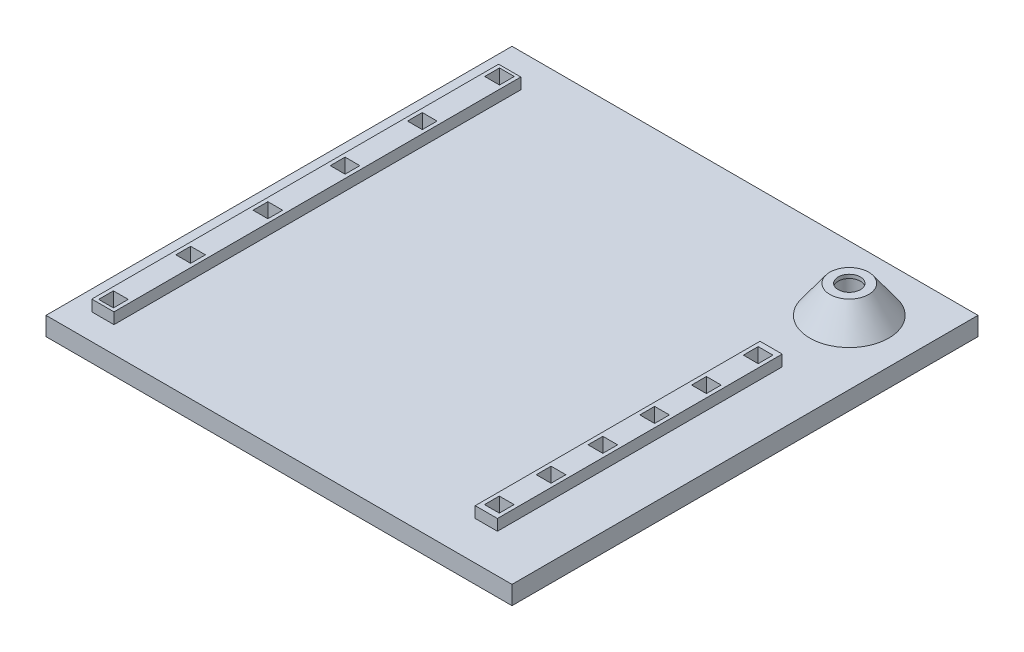
from build123d import *

# Parameters (mm, degrees)
SKETCH1_W           = 126
SKETCH1_H           = 126
BOSS_EXTRUDE1_DEPTH = 5
SKETCH3_R           = 12.5
BOSS_EXTRUDE2_DEPTH = 7.5
SKETCH4_R           = 3.45
CUT_EXTRUDE1_DEPTH  = 11.5
SKETCH6_R           = 3
CUT_EXTRUDE2_DEPTH  = 179.628805068
CHAMFER1_SIZE       = 10
CHAMFER1_SIZE_2     = 7.26542528
SKETCH9_W           = 6
SKETCH9_H           = 77
BOSS_EXTRUDE4_DEPTH = 3
SKETCH10_W          = 4
SKETCH10_H          = 4
CUT_EXTRUDE4_DEPTH  = 179.370401132
SKETCH11_W          = 6
SKETCH11_H          = 110
BOSS_EXTRUDE5_DEPTH = 3
SKETCH12_W          = 4
SKETCH12_H          = 4
CUT_EXTRUDE5_DEPTH  = 179.370401132


with BuildPart() as part:
    # Sketch1 → Boss-Extrude1 (new body)
    with BuildSketch(Plane(origin=(0, 0, 0), x_dir=(1, 0, 0), z_dir=(0, 1, 0))):
        with Locations((63, 63)):
            Rectangle(SKETCH1_W, SKETCH1_H)
    extrude(amount=BOSS_EXTRUDE1_DEPTH)

    # Sketch3 → Boss-Extrude2 (add)
    with BuildSketch(Plane(origin=(0, 5, 0), x_dir=(1, 0, 0), z_dir=(0, 1, 0))):
        with Locations(Location((108.6, 108.6, 0), (0, 0, 90))):
            Circle(SKETCH3_R)
    extrude(amount=BOSS_EXTRUDE2_DEPTH)

    # Sketch4 → Cut-Extrude1 (cut)
    with BuildSketch(Plane.XZ):
        with Locations(Location((108.6, -108.6, 0), (0, 0, 270))):
            Circle(SKETCH4_R)
    extrude(amount=-CUT_EXTRUDE1_DEPTH, mode=Mode.SUBTRACT)

    # Sketch6 → Cut-Extrude2 (cut, through all)
    with BuildSketch(Plane(origin=(0, 12.5, 0), x_dir=(1, 0, 0), z_dir=(0, 1, 0))):
        with Locations(Location((108.6, 108.6, 0), (0, 0, 270))):
            Circle(SKETCH6_R)
    extrude(amount=-CUT_EXTRUDE2_DEPTH, mode=Mode.SUBTRACT)

    # Chamfer1
    # the kernel refuses this chamfer: 10, 7.26542528 mm, written as the material it takes off along each edge
    with BuildSketch(Plane(origin=(108.6, 12.5, -108.6), x_dir=(0, 0, -1), z_dir=(1, 0, 0))) as chamfer1_piece_1_section:
        Polygon((12.5, -CHAMFER1_SIZE), (12.5 - CHAMFER1_SIZE_2, 0), (12.5, 0), align=None)
    chamfer1_piece_1 = revolve(axis=Axis((108.6, 12.5, -108.6), (0, 1, 0)), mode=Mode.PRIVATE)
    chamfer1_piece_1 = split(chamfer1_piece_1, bisect_by=Plane(origin=(108.6, 5, -100.650989912), z_dir=(0, 1, 0)), keep=Keep.TOP, mode=Mode.PRIVATE)
    add(chamfer1_piece_1, mode=Mode.SUBTRACT)

    # Sketch9 → Boss-Extrude4 (add)
    with BuildSketch(Plane(origin=(0, 5, 0), x_dir=(1, 0, 0), z_dir=(0, 1, 0))):
        with Locations((108.6, 48.95817816)):
            Rectangle(SKETCH9_W, SKETCH9_H)
    extrude(amount=BOSS_EXTRUDE4_DEPTH)

    # Sketch10 → Cut-Extrude4 (cut, through all)
    with BuildSketch(Plane(origin=(0, 8, 0), x_dir=(1, 0, 0), z_dir=(0, 1, 0))):
        with Locations((108.6, 83.95817816)):
            Rectangle(SKETCH10_W, SKETCH10_H)
        with Locations((108.6, 69.958932274)):
            Rectangle(SKETCH10_W, SKETCH10_H)
        with Locations((108.6, 55.959686388)):
            Rectangle(SKETCH10_W, SKETCH10_H)
        with Locations((108.6, 41.960440502)):
            Rectangle(SKETCH10_W, SKETCH10_H)
        with Locations((108.6, 27.961194616)):
            Rectangle(SKETCH10_W, SKETCH10_H)
        with Locations((108.6, 13.96194873)):
            Rectangle(SKETCH10_W, SKETCH10_H)
    extrude(amount=-CUT_EXTRUDE4_DEPTH, mode=Mode.SUBTRACT)

    # Sketch11 → Boss-Extrude5 (add)
    with BuildSketch(Plane(origin=(0, 5, 0), x_dir=(1, 0, 0), z_dir=(0, 1, 0))):
        with Locations((8.381061813, 62)):
            Rectangle(SKETCH11_W, SKETCH11_H)
    extrude(amount=BOSS_EXTRUDE5_DEPTH)

    # Sketch12 → Cut-Extrude5 (cut, through all)
    with BuildSketch(Plane(origin=(0, 8, 0), x_dir=(1, 0, 0), z_dir=(0, 1, 0))):
        with Locations((8.381061813, 114.236582212)):
            Rectangle(SKETCH12_W, SKETCH12_H)
        with Locations((8.381061813, 93.358892092)):
            Rectangle(SKETCH12_W, SKETCH12_H)
        with Locations((8.381061813, 72.481201972)):
            Rectangle(SKETCH12_W, SKETCH12_H)
        with Locations((8.381061813, 51.603511852)):
            Rectangle(SKETCH12_W, SKETCH12_H)
        with Locations((8.381061813, 30.725821731)):
            Rectangle(SKETCH12_W, SKETCH12_H)
        with Locations((8.381061813, 9.848131611)):
            Rectangle(SKETCH12_W, SKETCH12_H)
    extrude(amount=-CUT_EXTRUDE5_DEPTH, mode=Mode.SUBTRACT)


solid = part.part
